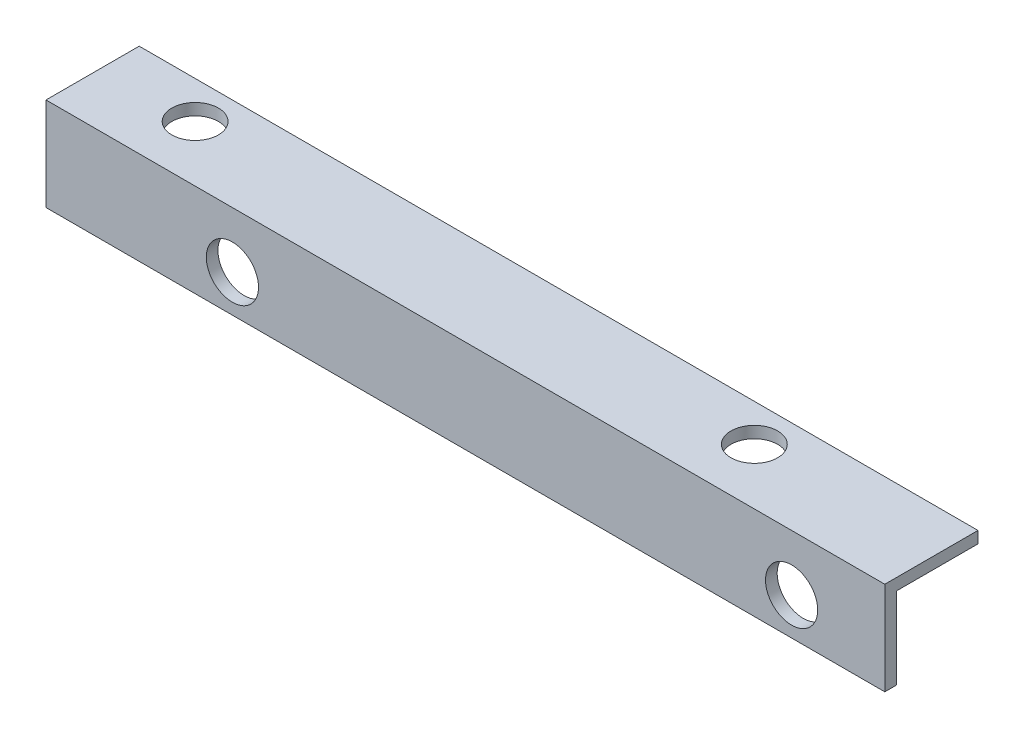
from build123d import *

# Parameters (mm, degrees)
BOSS_EXTRUDE1_DEPTH      = 57.15
BOSS_EXTRUDE1_DEPTH_BACK = 57.15
SKETCH3_R                = 3.556
CUT_EXTRUDE1_DEPTH       = 60.905780189
SKETCH4_R                = 3.175
CUT_EXTRUDE2_DEPTH       = 60.905780189


with BuildPart() as part:
    # Sketch1 → Boss-Extrude1 (new, two sides: drawn at the far end of the back side and taken through both)
    with BuildSketch(Plane(origin=(0, 0, 0), x_dir=(0, 0, -1), z_dir=(1, 0, 0)).offset(-BOSS_EXTRUDE1_DEPTH_BACK)):
        Polygon((0, 0), (0, 12.7), (12.7, 12.7), (12.7, 11.1125), (1.5875, 11.1125), (1.5875, 0), align=None)
    extrude(amount=BOSS_EXTRUDE1_DEPTH + BOSS_EXTRUDE1_DEPTH_BACK)

    # Sketch3 → Cut-Extrude1 (cut, through all)
    with BuildSketch(Plane.XY):
        with Locations((-31.75, 5.08)):
            Circle(SKETCH3_R)
        with Locations((44.45, 5.08)):
            Circle(SKETCH3_R)
    extrude(amount=-CUT_EXTRUDE1_DEPTH, mode=Mode.SUBTRACT)

    # Sketch4 → Cut-Extrude2 (cut, through all)
    with BuildSketch(Plane(origin=(0, 12.7, 0), x_dir=(1, 0, 0), z_dir=(0, 1, 0))):
        with Locations((-44.45, 7.62)):
            Circle(SKETCH4_R)
        with Locations((31.75, 7.62)):
            Circle(SKETCH4_R)
    extrude(amount=-CUT_EXTRUDE2_DEPTH, mode=Mode.SUBTRACT)


solid = part.part
